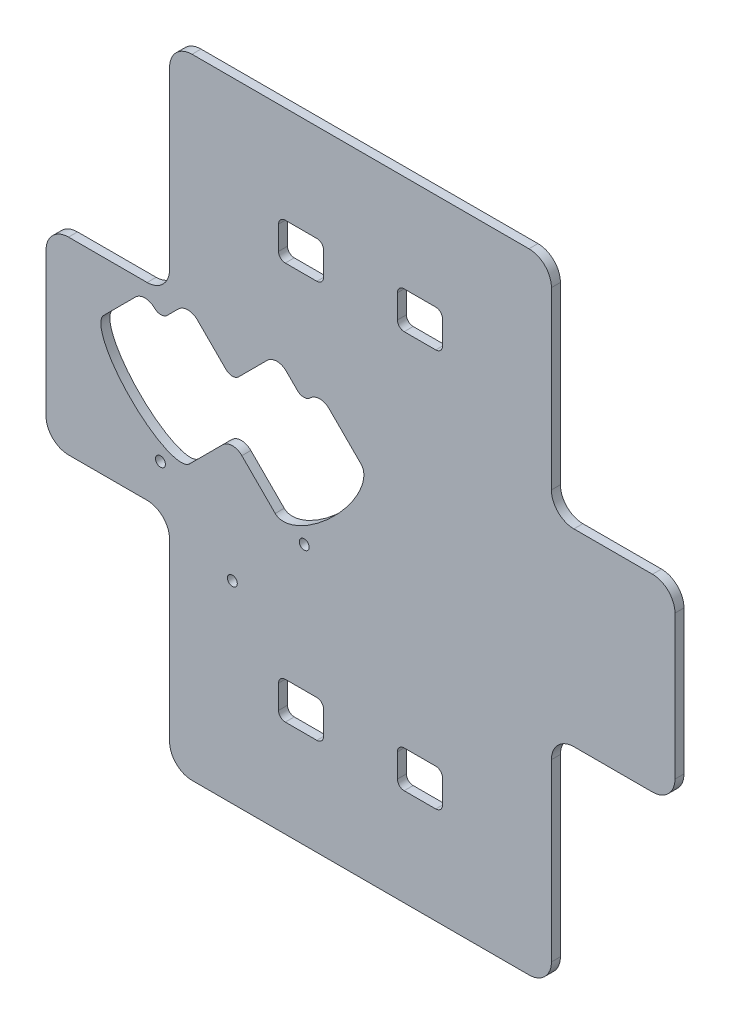
from build123d import *

# Parameters (mm, degrees)
EXTRUDE_1_DEPTH                           = 4
CUT_EXTRUDE_1_REACH                       = 200.03
MIRROR_1_AT_THE_SECOND_PLANE_COPY_1_REACH = 200.03
CUT_EXTRUDE_2_REACH                       = 200.03
FILLET_1_R                                = 4
FILLET_2_R                                = 6
CUT_EXTRUDE_3_REACH                       = 200.03
SKETCH_7_R                                = 2.2


with BuildPart() as part:
    # 草图1 → 凸台-拉伸1 (new body)
    with BuildSketch(Plane.XY):
        with BuildLine():
            Line((85, 52), (85, 130))
            ThreePointArc((85, 130), (82.071067812, 137.071067812), (75, 140))
            Line((75, 140), (-75, 140))
            ThreePointArc((-75, 140), (-82.071067812, 137.071067812), (-85, 130))
            Line((-85, 130), (-85, 52))
            ThreePointArc((-85, 52), (-87.928932188, 44.928932188), (-95, 42))
            Line((-95, 42), (-130, 42))
            ThreePointArc((-130, 42), (-137.071067812, 39.071067812), (-140, 32))
            Line((-140, 32), (-140, -32))
            ThreePointArc((-140, -32), (-137.071067812, -39.071067812), (-130, -42))
            Line((-130, -42), (-95, -42))
            ThreePointArc((-95, -42), (-87.928932188, -44.928932188), (-85, -52))
            Line((-85, -52), (-85, -130))
            ThreePointArc((-85, -130), (-82.071067812, -137.071067812), (-75, -140))
            Line((-75, -140), (75, -140))
            ThreePointArc((75, -140), (82.071067812, -137.071067812), (85, -130))
            Line((85, -130), (85, -52))
            ThreePointArc((85, -52), (87.928932188, -44.928932188), (95, -42))
            Line((95, -42), (130, -42))
            ThreePointArc((130, -42), (137.071067812, -39.071067812), (140, -32))
            Line((140, -32), (140, 32))
            ThreePointArc((140, 32), (137.071067812, 39.071067812), (130, 42))
            Line((130, 42), (95, 42))
            ThreePointArc((95, 42), (87.928932188, 44.928932188), (85, 52))
        make_face()
    extrude(amount=EXTRUDE_1_DEPTH)

    # 草图2 → 切除-拉伸1 (cut, up to next)
    with BuildSketch(Plane.XY.offset(4), mode=Mode.PRIVATE) as cut_extrude_1_sk1:
        with BuildLine():
            Line((33.5, -96.75), (19.436562746, -96.75))
            ThreePointArc((19.436562746, -96.75), (17.315242402, -95.871320344), (16.436562746, -93.75))
            Line((16.436562746, -93.75), (16.436562746, -83.25))
            ThreePointArc((16.436562746, -83.25), (17.315242402, -81.128679656), (19.436562746, -80.25))
            Line((19.436562746, -80.25), (33.5, -80.25))
            ThreePointArc((33.5, -80.25), (35.621320344, -81.128679656), (36.5, -83.25))
            Line((36.5, -83.25), (36.5, -93.75))
            ThreePointArc((36.5, -93.75), (35.621320344, -95.871320344), (33.5, -96.75))
        make_face()
    cut_extrude_1_tool1 = extrude(cut_extrude_1_sk1.sketch, amount=-CUT_EXTRUDE_1_REACH, mode=Mode.PRIVATE) & part.part
    cut_extrude_1 = cut_extrude_1_tool1.solids().sort_by_distance((26.468281, -88.5, 4))[0]
    add(cut_extrude_1, mode=Mode.SUBTRACT)

    # 镜向1: 切除-拉伸1 across plane
    add(cut_extrude_1.mirror(Plane(origin=(0, 0, 0), x_dir=(0, 0, 1), z_dir=(1, 0, 0))), mode=Mode.SUBTRACT)

    # 镜向1 at the second plane: 切除-拉伸1 across plane
    add(cut_extrude_1.mirror(Plane.ZX), mode=Mode.SUBTRACT)

    # 镜向1 at the second plane copy 1 sket → 镜向1 at the second plane copy 1 (cut, up to next)
    with BuildSketch(Plane(origin=(0, 0, 4), x_dir=(-1, 0, 0), z_dir=(0, 0, 1)), mode=Mode.PRIVATE) as mirror_1_at_the_second_plane_copy_1_sk1:
        with BuildLine():
            Line((33.5, -96.75), (19.436562746, -96.75))
            ThreePointArc((19.436562746, -96.75), (17.315242402, -95.871320344), (16.436562746, -93.75))
            Line((16.436562746, -93.75), (16.436562746, -83.25))
            ThreePointArc((16.436562746, -83.25), (17.315242402, -81.128679656), (19.436562746, -80.25))
            Line((19.436562746, -80.25), (33.5, -80.25))
            ThreePointArc((33.5, -80.25), (35.621320344, -81.128679656), (36.5, -83.25))
            Line((36.5, -83.25), (36.5, -93.75))
            ThreePointArc((36.5, -93.75), (35.621320344, -95.871320344), (33.5, -96.75))
        make_face()
    mirror_1_at_the_second_plane_copy_1_tool1 = extrude(mirror_1_at_the_second_plane_copy_1_sk1.sketch, amount=-MIRROR_1_AT_THE_SECOND_PLANE_COPY_1_REACH, mode=Mode.PRIVATE) & part.part
    add(mirror_1_at_the_second_plane_copy_1_tool1.solids().sort_by_distance((-26.468281, 88.5, 4))[0], mode=Mode.SUBTRACT)

    # 草图6 → 切除-拉伸2 (cut, up to next)
    with BuildSketch(Plane(origin=(0, 0, 0), x_dir=(-1, 0, 0), z_dir=(0, 0, -1)), mode=Mode.PRIVATE) as cut_extrude_2_sk1:
        with BuildLine():
            Line((114.339040254, 19.642746522), (95.954263943, 38.027522832))
            Line((95.954263943, 38.027522832), (88.883196131, 30.956455021))
            Line((88.883196131, 30.956455021), (76.862380851, 42.977270301))
            Line((76.862380851, 42.977270301), (57.063390978, 23.178280428))
            Line((57.063390978, 23.178280428), (37.264401104, 42.977270301))
            Line((37.264401104, 42.977270301), (25.243585824, 30.956455021))
            Line((25.243585824, 30.956455021), (18.172518012, 38.027522832))
            Line((18.172518012, 38.027522832), (-0.212258298, 19.642746522))
            add(Edge.make_bspline(
                [(37.971507886, -18.541019662), (45.042575698, -11.469951851), (25.950692606, 7.621931241), (6.858809513, 26.713814333), (-0.212258298, 19.642746522)],
                knots=[3.141592654, 3.141592654, 3.141592654, 4.71238898, 4.71238898, 6.283185307, 6.283185307, 6.283185307], degree=2, weights=[1, 0.707106781, 1, 0.707106781, 1]))
            Line((37.971507886, -18.541019662), (57.063390978, 0.55086343))
            Line((57.063390978, 0.55086343), (76.15527407, -18.541019662))
            add(Edge.make_bspline(
                [(114.339040254, 19.642746522), (107.267972442, 26.713814333), (88.17608935, 7.621931241), (69.084206258, -11.469951851), (76.15527407, -18.541019662)],
                knots=[0, 0, 0, 1.570796327, 1.570796327, 3.141592654, 3.141592654, 3.141592654], degree=2, weights=[1, 0.707106781, 1, 0.707106781, 1]))
        make_face()
    cut_extrude_2_tool1 = extrude(cut_extrude_2_sk1.sketch, amount=-CUT_EXTRUDE_2_REACH, mode=Mode.PRIVATE) & part.part
    # 草图6 → 切除-拉伸2 (cut, up to next)
    with BuildSketch(Plane(origin=(0, 0, 0), x_dir=(-1, 0, 0), z_dir=(0, 0, -1)), mode=Mode.PRIVATE) as cut_extrude_2_sk2:
        with BuildLine():
            add(Edge.make_bspline(
                [(-0.212258298, 19.642746522), (-7.28332611, 12.57167871), (11.808556982, -6.520204382), (30.900440074, -25.612087474), (37.971507886, -18.541019662)],
                knots=[0, 0, 0, 1.570796327, 1.570796327, 3.141592654, 3.141592654, 3.141592654], degree=2, weights=[1, 0.707106781, 1, 0.707106781, 1]))
            Line((37.971507886, -18.541019662), (-0.212258298, 19.642746522))
        make_face()
    cut_extrude_2_tool2 = extrude(cut_extrude_2_sk2.sketch, amount=-CUT_EXTRUDE_2_REACH, mode=Mode.PRIVATE) & part.part
    # 草图6 → 切除-拉伸2 (cut, up to next)
    with BuildSketch(Plane(origin=(0, 0, 0), x_dir=(-1, 0, 0), z_dir=(0, 0, -1)), mode=Mode.PRIVATE) as cut_extrude_2_sk3:
        with BuildLine():
            Line((-0.212258298, 19.642746522), (37.971507886, -18.541019662))
            add(Edge.make_bspline(
                [(37.971507886, -18.541019662), (45.042575698, -11.469951851), (25.950692606, 7.621931241), (6.858809513, 26.713814333), (-0.212258298, 19.642746522)],
                knots=[3.141592654, 3.141592654, 3.141592654, 4.71238898, 4.71238898, 6.283185307, 6.283185307, 6.283185307], degree=2, weights=[1, 0.707106781, 1, 0.707106781, 1]))
        make_face()
    cut_extrude_2_tool3 = extrude(cut_extrude_2_sk3.sketch, amount=-CUT_EXTRUDE_2_REACH, mode=Mode.PRIVATE) & part.part
    # 草图6 → 切除-拉伸2 (cut, up to next)
    with BuildSketch(Plane(origin=(0, 0, 0), x_dir=(-1, 0, 0), z_dir=(0, 0, -1)), mode=Mode.PRIVATE) as cut_extrude_2_sk4:
        with BuildLine():
            add(Edge.make_bspline(
                [(-0.212258298, 19.642746522), (-7.28332611, 12.57167871), (11.808556982, -6.520204382), (30.900440074, -25.612087474), (37.971507886, -18.541019662)],
                knots=[0, 0, 0, 1.570796327, 1.570796327, 3.141592654, 3.141592654, 3.141592654], degree=2, weights=[1, 0.707106781, 1, 0.707106781, 1]))
            Line((37.971507886, -18.541019662), (-0.212258298, 19.642746522))
        make_face()
    cut_extrude_2_tool4 = extrude(cut_extrude_2_sk4.sketch, amount=-CUT_EXTRUDE_2_REACH, mode=Mode.PRIVATE) & part.part
    # 草图6 → 切除-拉伸2 (cut, up to next)
    with BuildSketch(Plane(origin=(0, 0, 0), x_dir=(-1, 0, 0), z_dir=(0, 0, -1)), mode=Mode.PRIVATE) as cut_extrude_2_sk5:
        with BuildLine():
            Line((-0.212258298, 19.642746522), (37.971507886, -18.541019662))
            add(Edge.make_bspline(
                [(37.971507886, -18.541019662), (45.042575698, -11.469951851), (25.950692606, 7.621931241), (6.858809513, 26.713814333), (-0.212258298, 19.642746522)],
                knots=[3.141592654, 3.141592654, 3.141592654, 4.71238898, 4.71238898, 6.283185307, 6.283185307, 6.283185307], degree=2, weights=[1, 0.707106781, 1, 0.707106781, 1]))
        make_face()
    cut_extrude_2_tool5 = extrude(cut_extrude_2_sk5.sketch, amount=-CUT_EXTRUDE_2_REACH, mode=Mode.PRIVATE) & part.part
    # 草图6 → 切除-拉伸2 (cut, up to next)
    with BuildSketch(Plane(origin=(0, 0, 0), x_dir=(-1, 0, 0), z_dir=(0, 0, -1)), mode=Mode.PRIVATE) as cut_extrude_2_sk6:
        with BuildLine():
            add(Edge.make_bspline(
                [(76.15527407, -18.541019662), (83.226341882, -25.612087474), (102.318224974, -6.520204382), (121.410108066, 12.57167871), (114.339040254, 19.642746522)],
                knots=[3.141592654, 3.141592654, 3.141592654, 4.71238898, 4.71238898, 6.283185307, 6.283185307, 6.283185307], degree=2, weights=[1, 0.707106781, 1, 0.707106781, 1]))
            Line((114.339040254, 19.642746522), (76.15527407, -18.541019662))
        make_face()
    cut_extrude_2_tool6 = extrude(cut_extrude_2_sk6.sketch, amount=-CUT_EXTRUDE_2_REACH, mode=Mode.PRIVATE) & part.part
    # 草图6 → 切除-拉伸2 (cut, up to next)
    with BuildSketch(Plane(origin=(0, 0, 0), x_dir=(-1, 0, 0), z_dir=(0, 0, -1)), mode=Mode.PRIVATE) as cut_extrude_2_sk7:
        with BuildLine():
            Line((76.15527407, -18.541019662), (114.339040254, 19.642746522))
            add(Edge.make_bspline(
                [(114.339040254, 19.642746522), (107.267972442, 26.713814333), (88.17608935, 7.621931241), (69.084206258, -11.469951851), (76.15527407, -18.541019662)],
                knots=[0, 0, 0, 1.570796327, 1.570796327, 3.141592654, 3.141592654, 3.141592654], degree=2, weights=[1, 0.707106781, 1, 0.707106781, 1]))
        make_face()
    cut_extrude_2_tool7 = extrude(cut_extrude_2_sk7.sketch, amount=-CUT_EXTRUDE_2_REACH, mode=Mode.PRIVATE) & part.part
    # 草图6 → 切除-拉伸2 (cut, up to next)
    with BuildSketch(Plane(origin=(0, 0, 0), x_dir=(-1, 0, 0), z_dir=(0, 0, -1)), mode=Mode.PRIVATE) as cut_extrude_2_sk8:
        with BuildLine():
            add(Edge.make_bspline(
                [(76.15527407, -18.541019662), (83.226341882, -25.612087474), (102.318224974, -6.520204382), (121.410108066, 12.57167871), (114.339040254, 19.642746522)],
                knots=[3.141592654, 3.141592654, 3.141592654, 4.71238898, 4.71238898, 6.283185307, 6.283185307, 6.283185307], degree=2, weights=[1, 0.707106781, 1, 0.707106781, 1]))
            Line((114.339040254, 19.642746522), (76.15527407, -18.541019662))
        make_face()
    cut_extrude_2_tool8 = extrude(cut_extrude_2_sk8.sketch, amount=-CUT_EXTRUDE_2_REACH, mode=Mode.PRIVATE) & part.part
    # 草图6 → 切除-拉伸2 (cut, up to next)
    with BuildSketch(Plane(origin=(0, 0, 0), x_dir=(-1, 0, 0), z_dir=(0, 0, -1)), mode=Mode.PRIVATE) as cut_extrude_2_sk9:
        with BuildLine():
            Line((76.15527407, -18.541019662), (114.339040254, 19.642746522))
            add(Edge.make_bspline(
                [(114.339040254, 19.642746522), (107.267972442, 26.713814333), (88.17608935, 7.621931241), (69.084206258, -11.469951851), (76.15527407, -18.541019662)],
                knots=[0, 0, 0, 1.570796327, 1.570796327, 3.141592654, 3.141592654, 3.141592654], degree=2, weights=[1, 0.707106781, 1, 0.707106781, 1]))
        make_face()
    cut_extrude_2_tool9 = extrude(cut_extrude_2_sk9.sketch, amount=-CUT_EXTRUDE_2_REACH, mode=Mode.PRIVATE) & part.part
    add(cut_extrude_2_tool1.solids().sort_by_distance((-57.063391, 16.654228, 0))[0], mode=Mode.SUBTRACT)
    add(cut_extrude_2_tool2.solids().sort_by_distance((-15.933802, -2.435893, 0))[0], mode=Mode.SUBTRACT)
    add(cut_extrude_2_tool3.solids().sort_by_distance((-21.830862, 3.579723, 0))[0], mode=Mode.SUBTRACT)
    add(cut_extrude_2_tool4.solids().sort_by_distance((-15.933802, -2.435893, 0))[0], mode=Mode.SUBTRACT)
    add(cut_extrude_2_tool5.solids().sort_by_distance((-21.830862, 3.579723, 0))[0], mode=Mode.SUBTRACT)
    add(cut_extrude_2_tool6.solids().sort_by_distance((-98.198394, -2.477996, 0))[0], mode=Mode.SUBTRACT)
    add(cut_extrude_2_tool7.solids().sort_by_distance((-92.301335, 3.53762, 0))[0], mode=Mode.SUBTRACT)
    add(cut_extrude_2_tool8.solids().sort_by_distance((-98.198394, -2.477996, 0))[0], mode=Mode.SUBTRACT)
    add(cut_extrude_2_tool9.solids().sort_by_distance((-92.301335, 3.53762, 0))[0], mode=Mode.SUBTRACT)

    # 圆角1
    fillet_1_edges = [part.edges().sort_by_distance(p)[0] for p in [
        (-25.243585824, 30.956455021, 2),
        (-57.063390978, 23.178280428, 2),
        (-88.883196131, 30.956455021, 2),
    ]]
    fillet(fillet_1_edges, radius=FILLET_1_R)

    # 圆角2
    fillet_2_edges = [part.edges().sort_by_distance(p)[0] for p in [
        (-57.063390978, 0.55086343, 2),
        (-18.172518012, 38.027522832, 2),
        (-76.862380851, 42.977270301, 2),
        (-37.264401104, 42.977270301, 2),
        (-95.954263943, 38.027522832, 2),
    ]]
    fillet(fillet_2_edges, radius=FILLET_2_R - 0.0001)  # a hair under: the kernel refuses the full size

    # 草图7 → 切除-拉伸3 (cut, up to next)
    with BuildSketch(Plane.XY.offset(4), mode=Mode.PRIVATE) as cut_extrude_3_sk1:
        with Locations((-89.063390978, -24.041019662)):
            Circle(SKETCH_7_R)
    cut_extrude_3_tool1 = extrude(cut_extrude_3_sk1.sketch, amount=-CUT_EXTRUDE_3_REACH, mode=Mode.PRIVATE) & part.part
    # 草图7 → 切除-拉伸3 (cut, up to next)
    with BuildSketch(Plane.XY.offset(4), mode=Mode.PRIVATE) as cut_extrude_3_sk2:
        with Locations((-57.063390978, -54.041019663)):
            Circle(SKETCH_7_R)
    cut_extrude_3_tool2 = extrude(cut_extrude_3_sk2.sketch, amount=-CUT_EXTRUDE_3_REACH, mode=Mode.PRIVATE) & part.part
    # 草图7 → 切除-拉伸3 (cut, up to next)
    with BuildSketch(Plane.XY.offset(4), mode=Mode.PRIVATE) as cut_extrude_3_sk3:
        with Locations((-25.063390978, -24.041019662)):
            Circle(SKETCH_7_R)
    cut_extrude_3_tool3 = extrude(cut_extrude_3_sk3.sketch, amount=-CUT_EXTRUDE_3_REACH, mode=Mode.PRIVATE) & part.part
    add(cut_extrude_3_tool1.solids().sort_by_distance((-89.063391, -24.04102, 4))[0], mode=Mode.SUBTRACT)
    add(cut_extrude_3_tool2.solids().sort_by_distance((-57.063391, -54.04102, 4))[0], mode=Mode.SUBTRACT)
    add(cut_extrude_3_tool3.solids().sort_by_distance((-25.063391, -24.04102, 4))[0], mode=Mode.SUBTRACT)


solid = part.part
